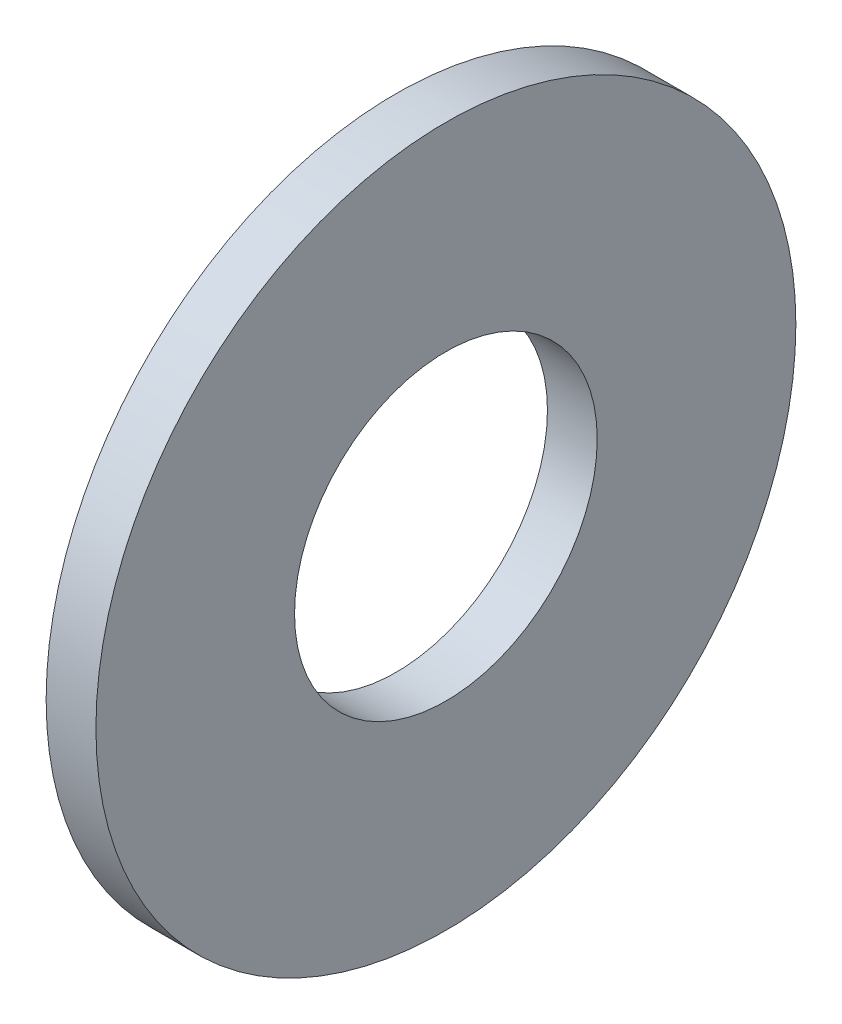
from build123d import *

# Parameters (mm, degrees)
SKETCH1_W = 6.4
SKETCH1_H = 25.54


with BuildPart() as part:
    # Sketch1 → Base-Revolve (revolve)
    with BuildSketch(Plane.XY):
        with Locations((-3.2, 32.23)):
            Rectangle(SKETCH1_W, SKETCH1_H)
    revolve(axis=Axis((-34.925, 0, 0), (1, 0, 0)))


solid = part.part
